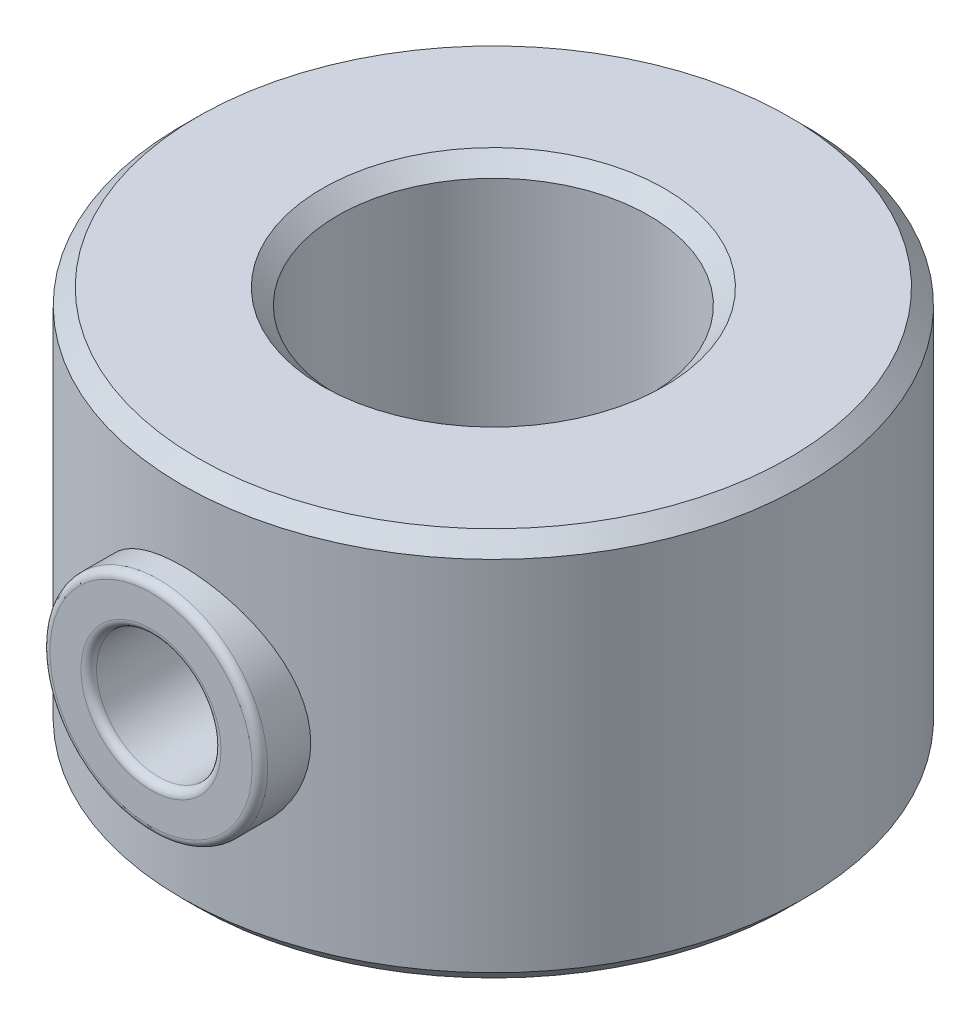
from build123d import *

# Parameters (mm, degrees)
SKETCH1_R           = 4
SKETCH1_R_2         = 2
BOSS_EXTRUDE1_DEPTH = 5
SKETCH2_R           = 1.4
BOSS_EXTRUDE2_DEPTH = 4.4
CUT_EXTRUDE1_START  = -4.2
SKETCH3_R           = 2
CUT_EXTRUDE1_DEPTH  = 4.2
SKETCH4_R           = 0.8
CUT_EXTRUDE2_DEPTH  = 4.2
FILLET1_R           = 0.1
CHAMFER1_SIZE       = 0.2


with BuildPart() as part:
    # Sketch1 → Boss-Extrude1 (new body)
    with BuildSketch(Plane(origin=(0, 0, 0), x_dir=(1, 0, 0), z_dir=(0, 1, 0))):
        Circle(SKETCH1_R)
        Circle(SKETCH1_R_2, mode=Mode.SUBTRACT)
    extrude(amount=BOSS_EXTRUDE1_DEPTH)

    # Sketch2 → Boss-Extrude2 (add)
    with BuildSketch(Plane.XY):
        with Locations((0, 2.5)):
            Circle(SKETCH2_R)
    extrude(amount=BOSS_EXTRUDE2_DEPTH)

    # Sketch3 → Cut-Extrude1 (cut)
    with BuildSketch(Plane(origin=(0, 5, 0), x_dir=(1, 0, 0), z_dir=(0, 1, 0)).offset(CUT_EXTRUDE1_START)):
        Circle(SKETCH3_R)
    extrude(amount=CUT_EXTRUDE1_DEPTH, mode=Mode.SUBTRACT)

    # Sketch4 → Cut-Extrude2 (cut)
    with BuildSketch(Plane.XY.offset(4.4)):
        with Locations((0, 2.5)):
            Circle(SKETCH4_R)
    extrude(amount=-CUT_EXTRUDE2_DEPTH, mode=Mode.SUBTRACT)

    # Fillet1
    fillet1_edges = [part.edges().sort_by_distance(p)[0] for p in [
        (-0.8, 2.5, 4.4),
        (-1.4, 2.5, 4.4),
    ]]
    fillet(fillet1_edges, radius=FILLET1_R)

    # Chamfer1
    chamfer1_edges = [part.edges().sort_by_distance(p)[0] for p in [
        (-2, 0, 0),
        (-4, 0, 0),
        (-2, 5, 0),
        (-4, 5, 0),
    ]]
    chamfer(chamfer1_edges, length=CHAMFER1_SIZE)


solid = part.part
